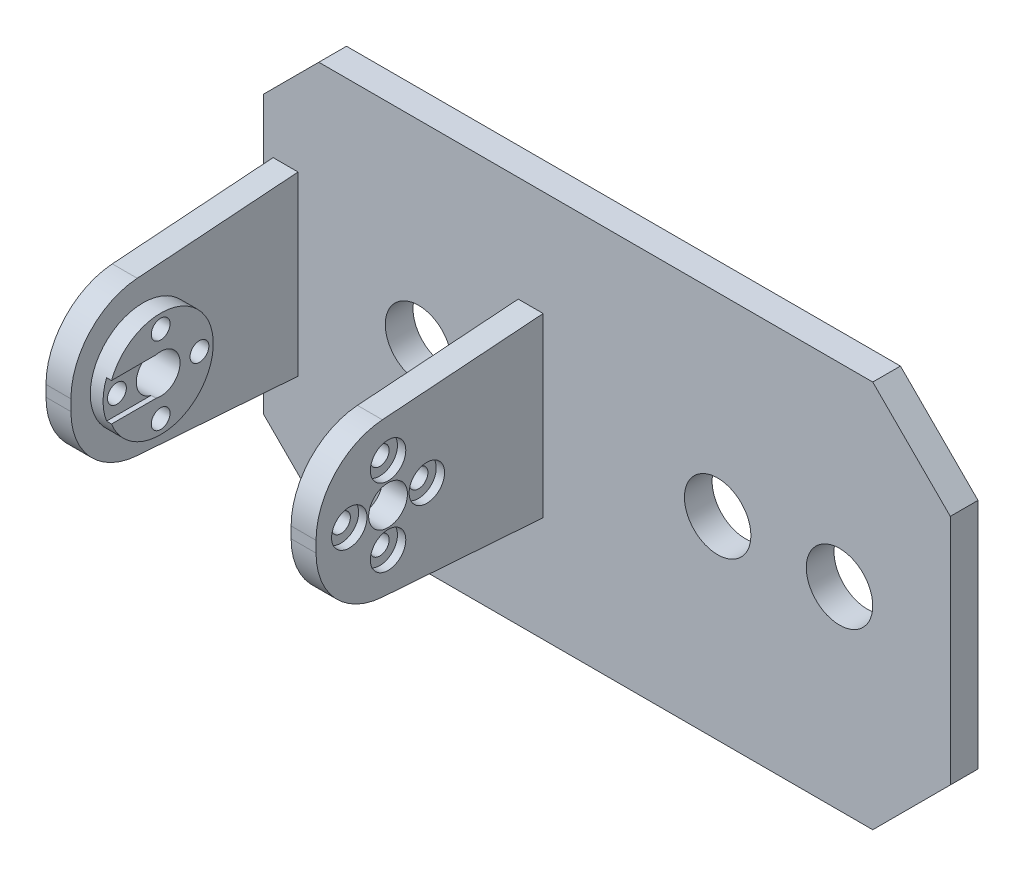
from build123d import *

# Parameters (mm, degrees)
BOSS_1_DEPTH    = 5
BOSS_2_DEPTH    = 4.5
S_CYL3_R        = 9.5
BOSS_3_DEPTH    = 3.2
BOSS_4_DEPTH    = 4.5
S_HOLE5_R       = 3.5
HOLE_5_DEPTH    = 4.7
S_HOLE6_R       = 1.7
HOLE_6_DEPTH    = 4.7
S_HOLE7_R       = 1.7
HOLE_7_DEPTH    = 4.7
S_HOLE8_R       = 1.7
HOLE_8_DEPTH    = 4.7
S_HOLE9_R       = 1.7
HOLE_9_DEPTH    = 4.7
S_HOLE10_R      = 3.2
HOLE_10_DEPTH   = 1.6
S_HOLE11_R      = 3.2
HOLE_11_DEPTH   = 1.6
S_HOLE12_R      = 3.2
HOLE_12_DEPTH   = 1.6
S_HOLE13_R      = 3.2
HOLE_13_DEPTH   = 1.6
S_HOLE14_R      = 3.5
HOLE_14_DEPTH   = 7.9
S_HOLE15_R      = 1.7
HOLE_15_DEPTH   = 7.9
S_HOLE16_R      = 1.7
HOLE_16_DEPTH   = 7.9
S_HOLE17_R      = 1.7
HOLE_17_DEPTH   = 7.9
S_HOLE18_R      = 1.7
HOLE_18_DEPTH   = 7.9
S_HOLE19_R      = 3.2
HOLE_19_DEPTH   = 2.1
S_HOLE20_R      = 3.2
HOLE_20_DEPTH   = 2.1
S_HOLE21_R      = 3.2
HOLE_21_DEPTH   = 2.1
S_HOLE22_R      = 3.2
HOLE_22_DEPTH   = 2.1
S_CUT23_W       = 1
S_CUT23_H       = 6.8
POCKET_23_DEPTH = 10
S_HOLE24_R      = 6
HOLE_24_DEPTH   = 5.2
S_HOLE25_R      = 6
HOLE_25_DEPTH   = 5.2
S_HOLE26_R      = 6
HOLE_26_DEPTH   = 5.2


with BuildPart() as part:
    # S_prism1 → Boss_1 (new body)
    with BuildSketch(Plane.XY.offset(-33)):
        Polygon((56, -21), (56, 21), (42, 35), (-58, 35), (-68, 25), (-68, -25), (-58, -35), (42, -35), align=None)
    extrude(amount=BOSS_1_DEPTH)

    # S_prism2 → Boss_2 (add)
    with BuildSketch(Plane(origin=(-22, 0, 0), x_dir=(0, 0, -1), z_dir=(1, 0, 0))):
        with BuildLine():
            Line((28.5, -16), (28.5, 16))
            Line((28.5, 16), (-1.0301, 13.8653))
            ThreePointArc((-1.0301, 13.8653), (-9.544808445, 9.785590923), (-13, 0.9989))
            Line((-13, 0.9989), (-13, -0.9989))
            ThreePointArc((-13, -0.9989), (-9.544808445, -9.785590923), (-1.0301, -13.8653))
            Line((-1.0301, -13.8653), (28.5, -16))
        make_face()
    extrude(amount=BOSS_2_DEPTH)



with BuildPart() as body_2:
    # S_cyl3 → Boss_3 (new body)
    with BuildSketch(Plane(origin=(-61.75, 0, 0), x_dir=(0, 0, -1), z_dir=(1, 0, 0))):
        Circle(S_CYL3_R)
    extrude(amount=BOSS_3_DEPTH)


with BuildPart() as part_1:
    add(part.part)

    add(body_2.part)  # Boss_4 merges body 2
    # S_prism4 → Boss_4 (add)
    with BuildSketch(Plane(origin=(-66.25, 0, 0), x_dir=(0, 0, -1), z_dir=(1, 0, 0))):
        with BuildLine():
            Line((28.5, -16), (28.5, 16))
            Line((28.5, 16), (-1.0301, 13.8653))
            ThreePointArc((-1.0301, 13.8653), (-9.544808445, 9.785590923), (-13, 0.9989))
            Line((-13, 0.9989), (-13, -0.9989))
            ThreePointArc((-13, -0.9989), (-9.544808445, -9.785590923), (-1.0301, -13.8653))
            Line((-1.0301, -13.8653), (28.5, -16))
        make_face()
    extrude(amount=BOSS_4_DEPTH)

    # S_hole5 → Hole_5 (cut)
    with BuildSketch(Plane(origin=(-22.1, 0, 0), x_dir=(0, 0, -1), z_dir=(1, 0, 0))):
        Circle(S_HOLE5_R)
    extrude(amount=HOLE_5_DEPTH, mode=Mode.SUBTRACT)

    # S_hole6 → Hole_6 (cut)
    with BuildSketch(Plane(origin=(-22.1, 0, 0), x_dir=(0, 0, -1), z_dir=(1, 0, 0))):
        with Locations((0, 7)):
            Circle(S_HOLE6_R)
    extrude(amount=HOLE_6_DEPTH, mode=Mode.SUBTRACT)

    # S_hole7 → Hole_7 (cut)
    with BuildSketch(Plane(origin=(-22.1, 0, 0), x_dir=(0, 0, -1), z_dir=(1, 0, 0))):
        with Locations((-7, 0)):
            Circle(S_HOLE7_R)
    extrude(amount=HOLE_7_DEPTH, mode=Mode.SUBTRACT)

    # S_hole8 → Hole_8 (cut)
    with BuildSketch(Plane(origin=(-22.1, 0, 0), x_dir=(0, 0, -1), z_dir=(1, 0, 0))):
        with Locations((0, -7)):
            Circle(S_HOLE8_R)
    extrude(amount=HOLE_8_DEPTH, mode=Mode.SUBTRACT)

    # S_hole9 → Hole_9 (cut)
    with BuildSketch(Plane(origin=(-22.1, 0, 0), x_dir=(0, 0, -1), z_dir=(1, 0, 0))):
        with Locations((7, 0)):
            Circle(S_HOLE9_R)
    extrude(amount=HOLE_9_DEPTH, mode=Mode.SUBTRACT)

    # S_hole10 → Hole_10 (cut)
    with BuildSketch(Plane(origin=(-19, 0, 0), x_dir=(0, 0, -1), z_dir=(1, 0, 0))):
        with Locations((0, 7)):
            Circle(S_HOLE10_R)
    extrude(amount=HOLE_10_DEPTH, mode=Mode.SUBTRACT)

    # S_hole11 → Hole_11 (cut)
    with BuildSketch(Plane(origin=(-19, 0, 0), x_dir=(0, 0, -1), z_dir=(1, 0, 0))):
        with Locations((-7, 0)):
            Circle(S_HOLE11_R)
    extrude(amount=HOLE_11_DEPTH, mode=Mode.SUBTRACT)

    # S_hole12 → Hole_12 (cut)
    with BuildSketch(Plane(origin=(-19, 0, 0), x_dir=(0, 0, -1), z_dir=(1, 0, 0))):
        with Locations((0, -7)):
            Circle(S_HOLE12_R)
    extrude(amount=HOLE_12_DEPTH, mode=Mode.SUBTRACT)

    # S_hole13 → Hole_13 (cut)
    with BuildSketch(Plane(origin=(-19, 0, 0), x_dir=(0, 0, -1), z_dir=(1, 0, 0))):
        with Locations((7, 0)):
            Circle(S_HOLE13_R)
    extrude(amount=HOLE_13_DEPTH, mode=Mode.SUBTRACT)

    # S_hole14 → Hole_14 (cut)
    with BuildSketch(Plane(origin=(-66.35, 0, 0), x_dir=(0, 0, -1), z_dir=(1, 0, 0))):
        Circle(S_HOLE14_R)
    extrude(amount=HOLE_14_DEPTH, mode=Mode.SUBTRACT)

    # S_hole15 → Hole_15 (cut)
    with BuildSketch(Plane(origin=(-66.35, 0, 0), x_dir=(0, 0, -1), z_dir=(1, 0, 0))):
        with Locations((0, 7)):
            Circle(S_HOLE15_R)
    extrude(amount=HOLE_15_DEPTH, mode=Mode.SUBTRACT)

    # S_hole16 → Hole_16 (cut)
    with BuildSketch(Plane(origin=(-66.35, 0, 0), x_dir=(0, 0, -1), z_dir=(1, 0, 0))):
        with Locations((-7, 0)):
            Circle(S_HOLE16_R)
    extrude(amount=HOLE_16_DEPTH, mode=Mode.SUBTRACT)

    # S_hole17 → Hole_17 (cut)
    with BuildSketch(Plane(origin=(-66.35, 0, 0), x_dir=(0, 0, -1), z_dir=(1, 0, 0))):
        with Locations((0, -7)):
            Circle(S_HOLE17_R)
    extrude(amount=HOLE_17_DEPTH, mode=Mode.SUBTRACT)

    # S_hole18 → Hole_18 (cut)
    with BuildSketch(Plane(origin=(-66.35, 0, 0), x_dir=(0, 0, -1), z_dir=(1, 0, 0))):
        with Locations((7, 0)):
            Circle(S_HOLE18_R)
    extrude(amount=HOLE_18_DEPTH, mode=Mode.SUBTRACT)

    # S_hole19 → Hole_19 (cut)
    with BuildSketch(Plane(origin=(-66.35, 0, 0), x_dir=(0, 0, -1), z_dir=(1, 0, 0))):
        with Locations((0, 7)):
            Circle(S_HOLE19_R)
    extrude(amount=HOLE_19_DEPTH, mode=Mode.SUBTRACT)

    # S_hole20 → Hole_20 (cut)
    with BuildSketch(Plane(origin=(-66.35, 0, 0), x_dir=(0, 0, -1), z_dir=(1, 0, 0))):
        with Locations((-7, 0)):
            Circle(S_HOLE20_R)
    extrude(amount=HOLE_20_DEPTH, mode=Mode.SUBTRACT)

    # S_hole21 → Hole_21 (cut)
    with BuildSketch(Plane(origin=(-66.35, 0, 0), x_dir=(0, 0, -1), z_dir=(1, 0, 0))):
        with Locations((0, -7)):
            Circle(S_HOLE21_R)
    extrude(amount=HOLE_21_DEPTH, mode=Mode.SUBTRACT)

    # S_hole22 → Hole_22 (cut)
    with BuildSketch(Plane(origin=(-66.35, 0, 0), x_dir=(0, 0, -1), z_dir=(1, 0, 0))):
        with Locations((7, 0)):
            Circle(S_HOLE22_R)
    extrude(amount=HOLE_22_DEPTH, mode=Mode.SUBTRACT)

    # S_cut23 → Pocket_23 (cut)
    with BuildSketch(Plane.XY):
        with Locations((-58.95, 0)):
            Rectangle(S_CUT23_W, S_CUT23_H)
    extrude(amount=POCKET_23_DEPTH, mode=Mode.SUBTRACT)

    # S_hole24 → Hole_24 (cut)
    with BuildSketch(Plane.XY.offset(-33.1)):
        with Locations((-40, 0)):
            Circle(S_HOLE24_R)
    extrude(amount=HOLE_24_DEPTH, mode=Mode.SUBTRACT)

    # S_hole25 → Hole_25 (cut)
    with BuildSketch(Plane.XY.offset(-33.1)):
        with Locations((14, 0)):
            Circle(S_HOLE25_R)
    extrude(amount=HOLE_25_DEPTH, mode=Mode.SUBTRACT)

    # S_hole26 → Hole_26 (cut)
    with BuildSketch(Plane.XY.offset(-33.1)):
        with Locations((36, 0)):
            Circle(S_HOLE26_R)
    extrude(amount=HOLE_26_DEPTH, mode=Mode.SUBTRACT)


solid = part_1.part
